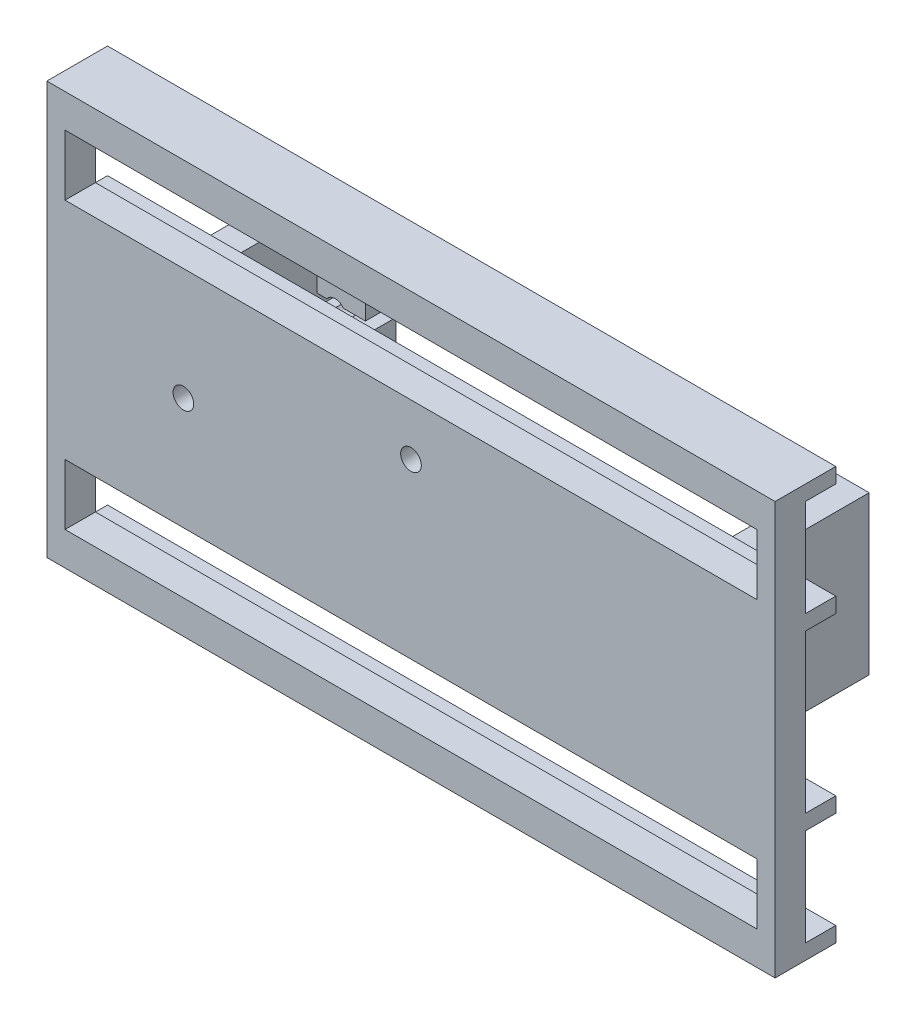
from build123d import *

# Parameters (mm, degrees)
SKETCH_1_W                 = 120
SKETCH_1_H                 = 68
EXTRUDE_1_DEPTH            = 5
SKETCH_2_W                 = 120
SKETCH_2_H                 = 2.5
EXTRUDE_2_DEPTH            = 5
CUT_EXTRUDE_1_REACH        = 71.145
SKETCH_3_W                 = 114
SKETCH_3_H                 = 10
SKETCH_4_W                 = 5
SKETCH_4_H                 = 26
EXTRUDE_3_DEPTH            = 20
SKETCH_5_W                 = 13
SKETCH_5_H                 = 26
EXTRUDE_4_DEPTH            = 5
CUT_EXTRUDE_2_REACH        = 77.206
SKETCH_6_W                 = 8
SKETCH_6_H                 = 2
HOLE_WIZARD_M3_1_OUTLINE_R = 1.7
HOLE_WIZARD_M3_1_DEPTH     = 5


# Read off the part's stored shape, not the designer's step: M3 すきま穴1
with BuildPart() as part:
    # ｽｹｯﾁ1 → ﾎﾞｽ - 押し出し1 (new body)
    with BuildSketch(Plane.XY):
        Rectangle(SKETCH_1_W, SKETCH_1_H)
    extrude(amount=EXTRUDE_1_DEPTH)

    # ｽｹｯﾁ2 → ﾎﾞｽ - 押し出し2 (add)
    with BuildSketch(Plane(origin=(0, 0, 0), x_dir=(-1, 0, 0), z_dir=(0, 0, -1))):
        with Locations((0, 32.75)):
            Rectangle(SKETCH_2_W, SKETCH_2_H)
        with Locations((0, 14.25)):
            Rectangle(SKETCH_2_W, SKETCH_2_H)
        with Locations((0, -14.25)):
            Rectangle(SKETCH_2_W, SKETCH_2_H)
        with Locations((0, -32.75)):
            Rectangle(SKETCH_2_W, SKETCH_2_H)
    extrude(amount=EXTRUDE_2_DEPTH)

    # ｽｹｯﾁ3 → ｶｯﾄ - 押し出し1 (cut, up to next)
    with BuildSketch(Plane(origin=(0, 0, 0), x_dir=(-1, 0, 0), z_dir=(0, 0, -1)), mode=Mode.PRIVATE) as cut_extrude_1_sk1:
        with Locations((0, 23.5)):
            Rectangle(SKETCH_3_W, SKETCH_3_H)
    cut_extrude_1_tool1 = extrude(cut_extrude_1_sk1.sketch, amount=-CUT_EXTRUDE_1_REACH, mode=Mode.PRIVATE) & part.part
    # ｽｹｯﾁ3 → ｶｯﾄ - 押し出し1 (cut, up to next)
    with BuildSketch(Plane(origin=(0, 0, 0), x_dir=(-1, 0, 0), z_dir=(0, 0, -1)), mode=Mode.PRIVATE) as cut_extrude_1_sk2:
        with Locations((0, -23.5)):
            Rectangle(SKETCH_3_W, SKETCH_3_H)
    cut_extrude_1_tool2 = extrude(cut_extrude_1_sk2.sketch, amount=-CUT_EXTRUDE_1_REACH, mode=Mode.PRIVATE) & part.part
    add(cut_extrude_1_tool1.solids().sort_by_distance((0, 23.5, 0))[0], mode=Mode.SUBTRACT)
    add(cut_extrude_1_tool2.solids().sort_by_distance((0, -23.5, 0))[0], mode=Mode.SUBTRACT)

    # ｽｹｯﾁ4 → ﾎﾞｽ - 押し出し3 (add)
    with BuildSketch(Plane(origin=(0, 0, 0), x_dir=(-1, 0, 0), z_dir=(0, 0, -1))):
        with Locations((-43, 0)):
            Rectangle(SKETCH_4_W, SKETCH_4_H)
        with Locations((43, 0)):
            Rectangle(SKETCH_4_W, SKETCH_4_H)
    extrude(amount=EXTRUDE_3_DEPTH)

    # ｽｹｯﾁ5 → ﾎﾞｽ - 押し出し4 (add)
    with BuildSketch(Plane(origin=(0, 0, -20), x_dir=(-1, 0, 0), z_dir=(0, 0, -1))):
        with Locations((-39, 0)):
            Rectangle(SKETCH_5_W, SKETCH_5_H)
        with Locations((39, 0)):
            Rectangle(SKETCH_5_W, SKETCH_5_H)
    extrude(amount=EXTRUDE_4_DEPTH)

    # ｽｹｯﾁ6 → ｶｯﾄ - 押し出し2 (cut, up to next)
    with BuildSketch(Plane(origin=(0, 0, -25), x_dir=(-1, 0, 0), z_dir=(0, 0, -1)), mode=Mode.PRIVATE) as cut_extrude_2_sk1:
        with Locations((-36.5, 0)):
            Rectangle(SKETCH_6_W, SKETCH_6_H)
    cut_extrude_2_tool1 = extrude(cut_extrude_2_sk1.sketch, amount=-CUT_EXTRUDE_2_REACH, mode=Mode.PRIVATE) & part.part
    # ｽｹｯﾁ6 → ｶｯﾄ - 押し出し2 (cut, up to next)
    with BuildSketch(Plane(origin=(0, 0, -25), x_dir=(-1, 0, 0), z_dir=(0, 0, -1)), mode=Mode.PRIVATE) as cut_extrude_2_sk2:
        with Locations((36.5, 0)):
            Rectangle(SKETCH_6_W, SKETCH_6_H)
    cut_extrude_2_tool2 = extrude(cut_extrude_2_sk2.sketch, amount=-CUT_EXTRUDE_2_REACH, mode=Mode.PRIVATE) & part.part
    add(cut_extrude_2_tool1.solids().sort_by_distance((36.5, 0, -25))[0], mode=Mode.SUBTRACT)
    add(cut_extrude_2_tool2.solids().sort_by_distance((-36.5, 0, -25))[0], mode=Mode.SUBTRACT)

    # M3 すきま穴1 outline → M3 すきま穴1 (cut)
    with BuildSketch(Plane.XY):
        with Locations((0, 10)):
            Circle(HOLE_WIZARD_M3_1_OUTLINE_R)
        with Locations((-37.5, 0)):
            Circle(HOLE_WIZARD_M3_1_OUTLINE_R)
    extrude(amount=HOLE_WIZARD_M3_1_DEPTH, mode=Mode.SUBTRACT)

    # Hole Wizard M3 _1 2 outline → Hole Wizard M3 _1 2 (revolve, cut)
    with BuildSketch(Plane(origin=(-37.5, 0, 0), x_dir=(1, 0, 0), z_dir=(0, -1, 0))):
        Polygon((1.7, -24.97124079), (1.7, -20), (0, -20), (0, -25.000000133), (1.725000116, -25.000000133), align=None)
    revolve(axis=Axis((-37.5, 0, 0), (0, 0, 1)), mode=Mode.SUBTRACT)

    # Hole Wizard M3 _1 3 outline → Hole Wizard M3 _1 3 (revolve, cut)
    with BuildSketch(Plane(origin=(-37.5, 10, 0), x_dir=(1, 0, 0), z_dir=(0, -1, 0))):
        Polygon((1.7, -24.97124079), (1.7, -20), (0, -20), (0, -25), (1.725, -25), align=None)
    revolve(axis=Axis((-37.5, 10, 0), (0, 0, 1)), mode=Mode.SUBTRACT)

    # Hole Wizard M3 _1 4 outline → Hole Wizard M3 _1 4 (revolve, cut)
    with BuildSketch(Plane(origin=(37.5, -10, 0), x_dir=(1, 0, 0), z_dir=(0, -1, 0))):
        Polygon((1.7, -24.97124079), (1.7, -20), (0, -20), (0, -25), (1.725, -25), align=None)
    revolve(axis=Axis((37.5, -10, 0), (0, 0, 1)), mode=Mode.SUBTRACT)

    # Hole Wizard M3 _1 5 outline → Hole Wizard M3 _1 5 (revolve, cut)
    with BuildSketch(Plane(origin=(-37.5, -10, 0), x_dir=(1, 0, 0), z_dir=(0, -1, 0))):
        Polygon((1.7, -24.97124079), (1.7, -20), (0, -20), (0, -25), (1.725, -25), align=None)
    revolve(axis=Axis((-37.5, -10, 0), (0, 0, 1)), mode=Mode.SUBTRACT)

    # Hole Wizard M3 _1 6 outline → Hole Wizard M3 _1 6 (revolve, cut)
    with BuildSketch(Plane(origin=(37.5, 10, 0), x_dir=(1, 0, 0), z_dir=(0, -1, 0))):
        Polygon((1.7, -24.97124079), (1.7, -20), (0, -20), (0, -25), (1.725, -25), align=None)
    revolve(axis=Axis((37.5, 10, 0), (0, 0, 1)), mode=Mode.SUBTRACT)


solid = part.part
